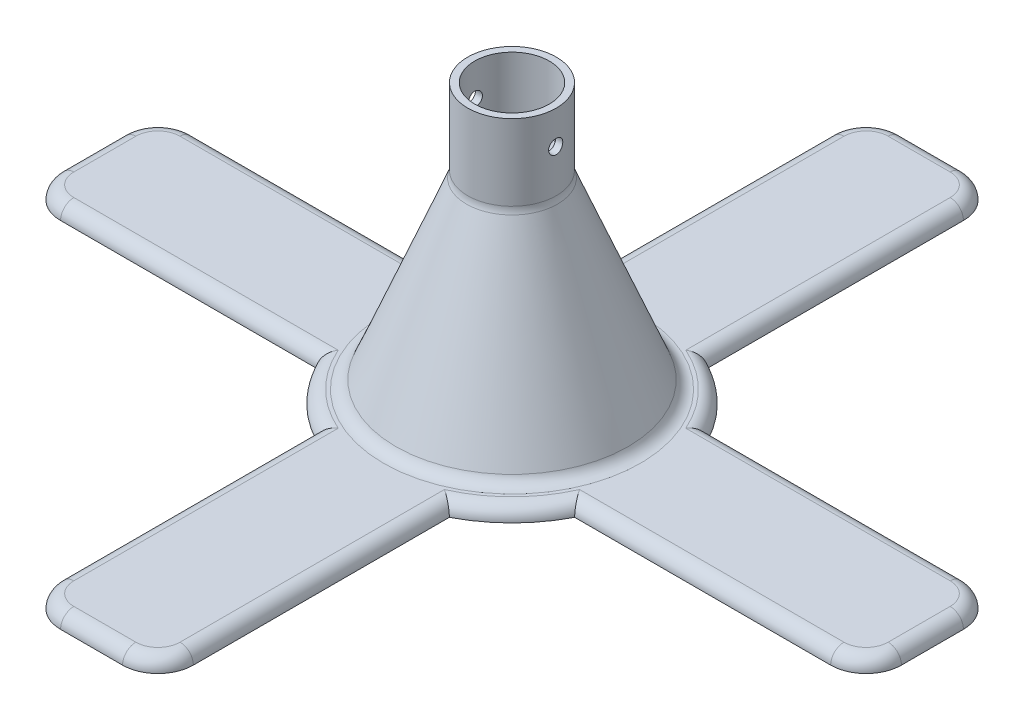
from build123d import *

# Parameters (mm, degrees)
BOSS_EXTRUDE1_DEPTH     = 3
FILLET4_R               = 8
FILLET5_R               = 3
SKETCH4_R               = 10
BOSS_EXTRUDE4_DEPTH     = 60
CHAMFER2_SIZE           = 17
CHAMFER2_SIZE2          = 42.076476508
FILLET7_R               = 4
FILLET8_R               = 3
SKETCH6_R               = 8.43
CUT_EXTRUDE2_DEPTH      = 15
CUT_EXTRUDE3_DEPTH      = 15
CUT_EXTRUDE3_DEPTH_BACK = 15


with BuildPart() as part:
    # Sketch1 → Boss-Extrude1 (new body)
    with BuildSketch(Plane(origin=(0, 0, 0), x_dir=(1, 0, 0), z_dir=(0, 1, 0))):
        with BuildLine():
            ThreePointArc((29.158991571, 15), (31.870032918, 7.716721534), (32.790955909, 0))
            Line((32.790955909, 0), (95, 0))
            Line((95, 0), (95, 15))
            Line((95, 15), (29.158991571, 15))
        make_face()
        with BuildLine():
            Line((95, 0), (32.790955909, 0))
            ThreePointArc((32.790955909, 0), (31.870032918, -7.716721534), (29.158991571, -15))
            Line((29.158991571, -15), (95, -15))
            Line((95, -15), (95, 0))
        make_face()
        with BuildLine():
            ThreePointArc((15, 29.158991571), (7.716721534, 31.870032918), (0, 32.790955909))
            Line((0, 32.790955909), (0, 0))
            Line((0, 0), (32.790955909, 0))
            ThreePointArc((32.790955909, 0), (31.870032918, 7.716721534), (29.158991571, 15))
            ThreePointArc((29.158991571, 15), (23.186707285, 23.186707285), (15, 29.158991571))
        make_face()
        with BuildLine():
            Line((0, 0), (0, 32.790955909))
            ThreePointArc((0, 32.790955909), (-7.716721534, 31.870032918), (-15, 29.158991571))
            ThreePointArc((-15, 29.158991571), (-23.186707285, 23.186707285), (-29.158991571, 15))
            ThreePointArc((-29.158991571, 15), (-31.870032918, 7.716721534), (-32.790955909, 0))
            Line((-32.790955909, 0), (0, 0))
        make_face()
        with BuildLine():
            Line((32.790955909, 0), (0, 0))
            Line((0, 0), (0, -32.790955909))
            ThreePointArc((0, -32.790955909), (7.716721534, -31.870032918), (15, -29.158991571))
            ThreePointArc((15, -29.158991571), (23.186707285, -23.186707285), (29.158991571, -15))
            ThreePointArc((29.158991571, -15), (31.870032918, -7.716721534), (32.790955909, 0))
        make_face()
        with BuildLine():
            Line((0, -32.790955909), (0, 0))
            Line((0, 0), (-32.790955909, 0))
            ThreePointArc((-32.790955909, 0), (-31.870032918, -7.716721534), (-29.158991571, -15))
            ThreePointArc((-29.158991571, -15), (-23.186707285, -23.186707285), (-15, -29.158991571))
            ThreePointArc((-15, -29.158991571), (-7.716721534, -31.870032918), (0, -32.790955909))
        make_face()
        with BuildLine():
            ThreePointArc((15, 29.158991571), (7.716721534, 31.870032918), (0, 32.790955909))
            Line((0, 32.790955909), (0, 0))
            Line((0, 0), (32.790955909, 0))
            ThreePointArc((32.790955909, 0), (31.870032918, 7.716721534), (29.158991571, 15))
            ThreePointArc((29.158991571, 15), (23.186707285, 23.186707285), (15, 29.158991571))
        make_face()
        with BuildLine():
            Line((0, 0), (0, 32.790955909))
            ThreePointArc((0, 32.790955909), (-7.716721534, 31.870032918), (-15, 29.158991571))
            ThreePointArc((-15, 29.158991571), (-23.186707285, 23.186707285), (-29.158991571, 15))
            ThreePointArc((-29.158991571, 15), (-31.870032918, 7.716721534), (-32.790955909, 0))
            Line((-32.790955909, 0), (0, 0))
        make_face()
        with BuildLine():
            Line((32.790955909, 0), (0, 0))
            Line((0, 0), (0, -32.790955909))
            ThreePointArc((0, -32.790955909), (7.716721534, -31.870032918), (15, -29.158991571))
            ThreePointArc((15, -29.158991571), (23.186707285, -23.186707285), (29.158991571, -15))
            ThreePointArc((29.158991571, -15), (31.870032918, -7.716721534), (32.790955909, 0))
        make_face()
        with BuildLine():
            Line((0, -32.790955909), (0, 0))
            Line((0, 0), (-32.790955909, 0))
            ThreePointArc((-32.790955909, 0), (-31.870032918, -7.716721534), (-29.158991571, -15))
            ThreePointArc((-29.158991571, -15), (-23.186707285, -23.186707285), (-15, -29.158991571))
            ThreePointArc((-15, -29.158991571), (-7.716721534, -31.870032918), (0, -32.790955909))
        make_face()
        with BuildLine():
            ThreePointArc((15, 29.158991571), (7.716721534, 31.870032918), (0, 32.790955909))
            Line((0, 32.790955909), (0, 0))
            Line((0, 0), (32.790955909, 0))
            ThreePointArc((32.790955909, 0), (31.870032918, 7.716721534), (29.158991571, 15))
            ThreePointArc((29.158991571, 15), (23.186707285, 23.186707285), (15, 29.158991571))
        make_face()
        with BuildLine():
            Line((0, 0), (0, 32.790955909))
            ThreePointArc((0, 32.790955909), (-7.716721534, 31.870032918), (-15, 29.158991571))
            ThreePointArc((-15, 29.158991571), (-23.186707285, 23.186707285), (-29.158991571, 15))
            ThreePointArc((-29.158991571, 15), (-31.870032918, 7.716721534), (-32.790955909, 0))
            Line((-32.790955909, 0), (0, 0))
        make_face()
        with BuildLine():
            Line((32.790955909, 0), (0, 0))
            Line((0, 0), (0, -32.790955909))
            ThreePointArc((0, -32.790955909), (7.716721534, -31.870032918), (15, -29.158991571))
            ThreePointArc((15, -29.158991571), (23.186707285, -23.186707285), (29.158991571, -15))
            ThreePointArc((29.158991571, -15), (31.870032918, -7.716721534), (32.790955909, 0))
        make_face()
        with BuildLine():
            Line((0, -32.790955909), (0, 0))
            Line((0, 0), (-32.790955909, 0))
            ThreePointArc((-32.790955909, 0), (-31.870032918, -7.716721534), (-29.158991571, -15))
            ThreePointArc((-29.158991571, -15), (-23.186707285, -23.186707285), (-15, -29.158991571))
            ThreePointArc((-15, -29.158991571), (-7.716721534, -31.870032918), (0, -32.790955909))
        make_face()
        with BuildLine():
            ThreePointArc((15, 29.158991571), (7.716721534, 31.870032918), (0, 32.790955909))
            Line((0, 32.790955909), (0, 0))
            Line((0, 0), (32.790955909, 0))
            ThreePointArc((32.790955909, 0), (31.870032918, 7.716721534), (29.158991571, 15))
            ThreePointArc((29.158991571, 15), (23.186707285, 23.186707285), (15, 29.158991571))
        make_face()
        with BuildLine():
            Line((0, 0), (0, 32.790955909))
            ThreePointArc((0, 32.790955909), (-7.716721534, 31.870032918), (-15, 29.158991571))
            ThreePointArc((-15, 29.158991571), (-23.186707285, 23.186707285), (-29.158991571, 15))
            ThreePointArc((-29.158991571, 15), (-31.870032918, 7.716721534), (-32.790955909, 0))
            Line((-32.790955909, 0), (0, 0))
        make_face()
        with BuildLine():
            Line((32.790955909, 0), (0, 0))
            Line((0, 0), (0, -32.790955909))
            ThreePointArc((0, -32.790955909), (7.716721534, -31.870032918), (15, -29.158991571))
            ThreePointArc((15, -29.158991571), (23.186707285, -23.186707285), (29.158991571, -15))
            ThreePointArc((29.158991571, -15), (31.870032918, -7.716721534), (32.790955909, 0))
        make_face()
        with BuildLine():
            Line((0, -32.790955909), (0, 0))
            Line((0, 0), (-32.790955909, 0))
            ThreePointArc((-32.790955909, 0), (-31.870032918, -7.716721534), (-29.158991571, -15))
            ThreePointArc((-29.158991571, -15), (-23.186707285, -23.186707285), (-15, -29.158991571))
            ThreePointArc((-15, -29.158991571), (-7.716721534, -31.870032918), (0, -32.790955909))
        make_face()
        with BuildLine():
            Line((0, 32.790955909), (0, 95))
            Line((0, 95), (-15, 95))
            Line((-15, 95), (-15, 29.158991571))
            ThreePointArc((-15, 29.158991571), (-7.716721534, 31.870032918), (0, 32.790955909))
        make_face()
        with BuildLine():
            Line((15, 95), (0, 95))
            Line((0, 95), (0, 32.790955909))
            ThreePointArc((0, 32.790955909), (7.716721534, 31.870032918), (15, 29.158991571))
            Line((15, 29.158991571), (15, 95))
        make_face()
        with BuildLine():
            Line((-95, 0), (-32.790955909, 0))
            ThreePointArc((-32.790955909, 0), (-31.870032918, 7.716721534), (-29.158991571, 15))
            Line((-29.158991571, 15), (-95, 15))
            Line((-95, 15), (-95, 0))
        make_face()
        with BuildLine():
            ThreePointArc((-29.158991571, -15), (-31.870032918, -7.716721534), (-32.790955909, 0))
            Line((-32.790955909, 0), (-95, 0))
            Line((-95, 0), (-95, -15))
            Line((-95, -15), (-29.158991571, -15))
        make_face()
        with BuildLine():
            Line((0, -95), (0, -32.790955909))
            ThreePointArc((0, -32.790955909), (-7.716721534, -31.870032918), (-15, -29.158991571))
            Line((-15, -29.158991571), (-15, -95))
            Line((-15, -95), (0, -95))
        make_face()
        with BuildLine():
            ThreePointArc((15, -29.158991571), (7.716721534, -31.870032918), (0, -32.790955909))
            Line((0, -32.790955909), (0, -95))
            Line((0, -95), (15, -95))
            Line((15, -95), (15, -29.158991571))
        make_face()
    extrude(amount=BOSS_EXTRUDE1_DEPTH)

    # Fillet4
    fillet4_edges = [part.edges().sort_by_distance(p)[0] for p in [
        (95, 1.5, -15),
        (95, 1.5, 15),
        (15, 1.5, 95),
        (-15, 1.5, 95),
        (-95, 1.5, 15),
        (-95, 1.5, -15),
        (-15, 1.5, -95),
        (15, 1.5, -95),
    ]]
    fillet(fillet4_edges, radius=FILLET4_R)

    # Fillet5
    fillet5_edges = [part.edges().sort_by_distance(p)[0] for p in [
        (-12.656854249, 3, 92.656854249),
        (-15, 3, 58.079495785),
        (-23.186707285, 3, 23.186707285),
        (-58.079495785, 3, 15),
        (-92.656854249, 3, 12.656854249),
        (-95, 3, 0),
        (-92.656854249, 3, -12.656854249),
        (-58.079495785, 3, -15),
        (-23.186707285, 3, -23.186707285),
        (-15, 3, -58.079495785),
        (-12.656854249, 3, -92.656854249),
        (0, 3, -95),
        (12.656854249, 3, -92.656854249),
        (15, 3, -58.079495785),
        (23.186707285, 3, -23.186707285),
        (58.079495785, 3, -15),
        (92.656854249, 3, -12.656854249),
        (95, 3, 0),
        (92.656854249, 3, 12.656854249),
        (58.079495785, 3, 15),
        (23.186707285, 3, 23.186707285),
        (15, 3, 58.079495785),
        (12.656854249, 3, 92.656854249),
        (0, 3, 95),
    ]]
    fillet(fillet5_edges, radius=FILLET5_R - 0.0001)  # a hair under: the kernel refuses the full size

    # Sketch4 → Boss-Extrude4 (add)
    with BuildSketch(Plane(origin=(0, 3, 0), x_dir=(1, 0, 0), z_dir=(0, 1, 0))):
        with Locations(Location((0, 0, 0), (0, 0, 270))):
            Circle(SKETCH4_R)
    extrude(amount=BOSS_EXTRUDE4_DEPTH)

    # Chamfer2
    chamfer2_edges = [part.edges().sort_by_distance(p)[0] for p in [
        (0, 3, -10),
    ]]
    chamfer2_side = [part.faces().sort_by_distance(p)[0] for p in [
        (9.397944217, 3, 57.133640491),
    ]]
    chamfer(chamfer2_edges, length=CHAMFER2_SIZE, length2=CHAMFER2_SIZE2, reference=chamfer2_side[0])

    # Fillet7
    fillet7_edges = [part.edges().sort_by_distance(p)[0] for p in [
        (0, 45.076476508, -10),
    ]]
    fillet(fillet7_edges, radius=FILLET7_R)

    # Fillet8
    fillet8_edges = [part.edges().sort_by_distance(p)[0] for p in [
        (0, 3, -27),
    ]]
    fillet(fillet8_edges, radius=FILLET8_R)

    # Sketch6 → Cut-Extrude2 (cut)
    with BuildSketch(Plane(origin=(0, 63, 0), x_dir=(1, 0, 0), z_dir=(0, 1, 0))):
        with Locations(Location((0, 0, 0), (0, 0, 270))):
            Circle(SKETCH6_R)
    extrude(amount=-CUT_EXTRUDE2_DEPTH, mode=Mode.SUBTRACT)

    # Sketch8 → Cut-Extrude3 (cut, two sides: drawn at the far end of the back side and taken through both)
    with BuildSketch(Plane(origin=(0, 0, 0), x_dir=(0, 0, -1), z_dir=(1, 0, 0)).offset(-CUT_EXTRUDE3_DEPTH_BACK)):
        with BuildLine():
            Line((0, 55.5), (0, 57.1))
            ThreePointArc((0, 57.1), (-1.6, 55.5), (0, 53.9))
            Line((0, 53.9), (0, 55.5))
        make_face()
        with BuildLine():
            ThreePointArc((1.6, 55.5), (1.13137085, 56.63137085), (0, 57.1))
            Line((0, 57.1), (0, 55.5))
            Line((0, 55.5), (1.6, 55.5))
        make_face()
        with BuildLine():
            Line((1.6, 55.5), (0, 55.5))
            Line((0, 55.5), (0, 53.9))
            ThreePointArc((0, 53.9), (1.13137085, 54.36862915), (1.6, 55.5))
        make_face()
        with BuildLine():
            ThreePointArc((1.6, 55.5), (1.13137085, 56.63137085), (0, 57.1))
            Line((0, 57.1), (0, 55.5))
            Line((0, 55.5), (1.6, 55.5))
        make_face()
        with BuildLine():
            Line((1.6, 55.5), (0, 55.5))
            Line((0, 55.5), (0, 53.9))
            ThreePointArc((0, 53.9), (1.13137085, 54.36862915), (1.6, 55.5))
        make_face()
    extrude(amount=CUT_EXTRUDE3_DEPTH + CUT_EXTRUDE3_DEPTH_BACK, mode=Mode.SUBTRACT)


solid = part.part
